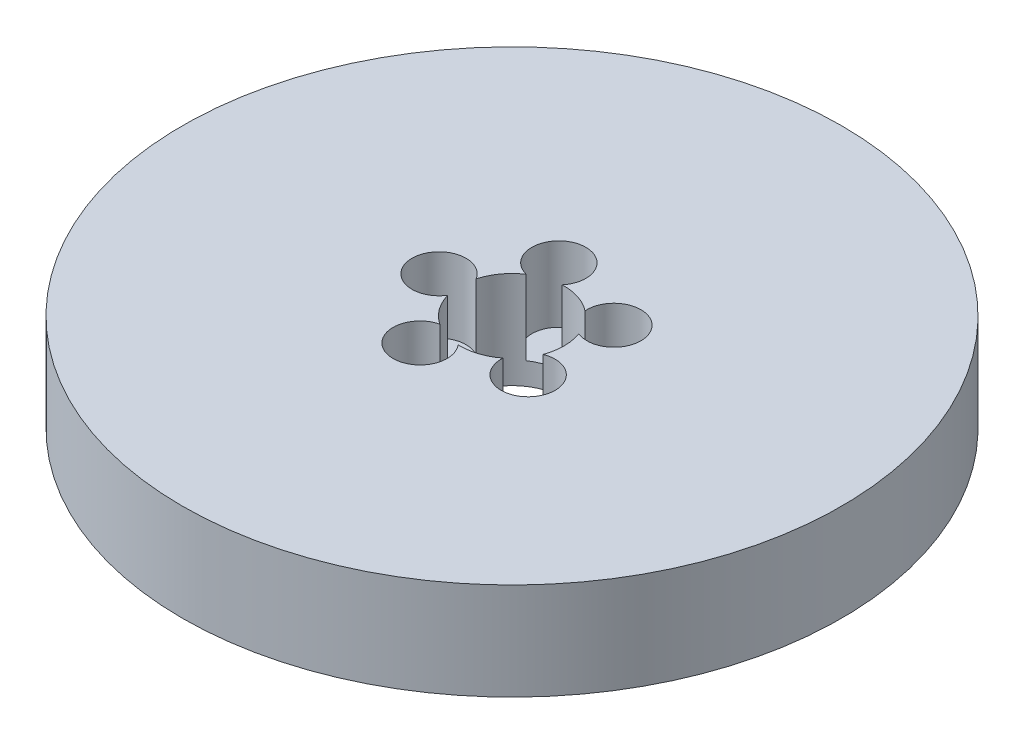
from build123d import *

# Parameters (mm, degrees)
SKETCH1_R           = 47.5
BOSS_EXTRUDE1_DEPTH = 14
SKETCH2_R           = 7.5
CUT_EXTRUDE1_DEPTH  = 69.618510622
SKETCH3_R           = 3.891762976
CUT_EXTRUDE2_DEPTH  = 10.792132813
CIRPATTERN1_COUNT   = 5


with BuildPart() as part:
    # Sketch1 → Boss-Extrude1 (new body)
    with BuildSketch(Plane(origin=(0, 0, 0), x_dir=(1, 0, 0), z_dir=(0, 1, 0))):
        Circle(SKETCH1_R)
    extrude(amount=BOSS_EXTRUDE1_DEPTH)

    # Sketch2 → Cut-Extrude1 (cut, through all)
    with BuildSketch(Plane(origin=(0, 0, 0), x_dir=(1, 0, 0), z_dir=(0, 1, 0))):
        Circle(SKETCH2_R)
    extrude(amount=CUT_EXTRUDE1_DEPTH, mode=Mode.SUBTRACT)

    # Sketch3 → Cut-Extrude2 (cut)
    with BuildSketch(Plane(origin=(0, 14, 0), x_dir=(1, 0, 0), z_dir=(0, 1, 0))):
        with Locations((-10.51572659, 0)):
            Circle(SKETCH3_R)
    cut_extrude2 = extrude(amount=-CUT_EXTRUDE2_DEPTH, mode=Mode.SUBTRACT)

    # CirPattern1: Cut-Extrude2 ×5 about axis
    cirpattern1_axis = Axis((0, 0, 0), (0, 1, 0))
    for i in range(1, CIRPATTERN1_COUNT):
        add(cut_extrude2.rotate(cirpattern1_axis, i * 360 / CIRPATTERN1_COUNT), mode=Mode.SUBTRACT)


solid = part.part
